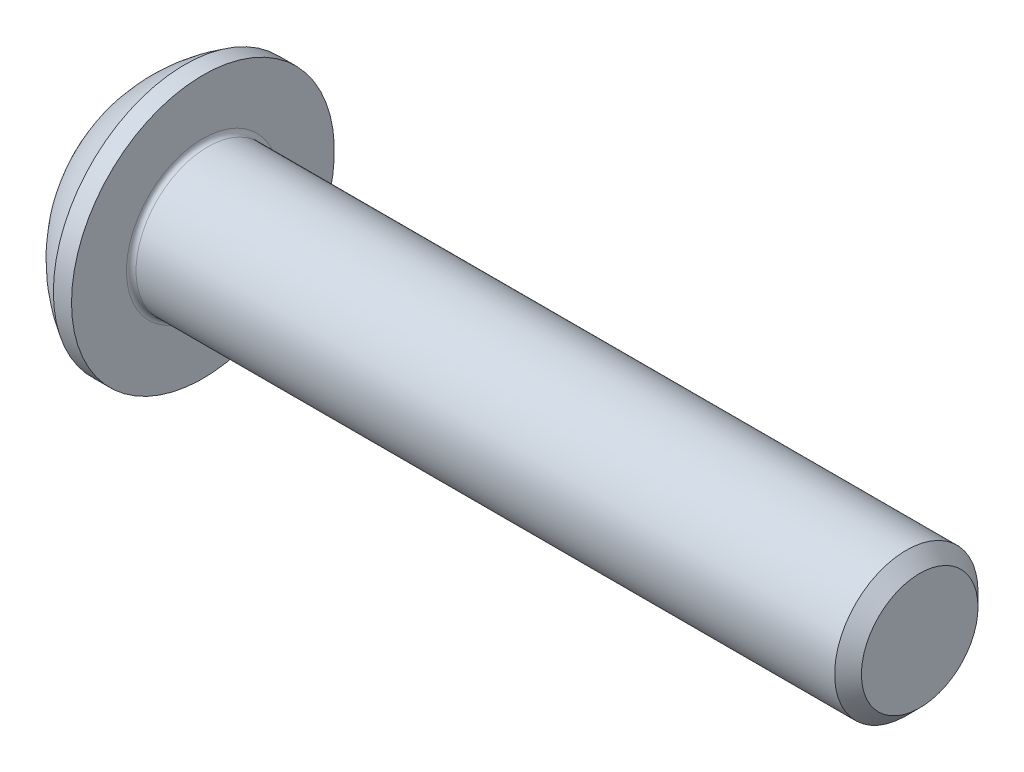
from build123d import *

# Parameters (mm, degrees)
CUT_EXTRUDE1_DEPTH        = 1.04
SKETCH4_R                 = 1.5
LARGO_Y_ANCHO_ROSCA_DEPTH = 15
FILLET1_R                 = 0.1
CHAMFER1_SIZE             = 0.2805


with BuildPart() as part:
    # Sketch1 → Revolve1 (revolve)
    with BuildSketch(Plane(origin=(0, 0, 0), x_dir=(-1, 0, 0), z_dir=(0, 0, -1))):
        with BuildLine():
            Line((-1.65, 2.75), (-1.65, 0))
            Line((-1.65, 0), (0, 0))
            Line((0, 0), (0, 1.425))
            ThreePointArc((0, 1.425), (-0.542530893, 2.176130767), (-1.27, 2.75))
            Line((-1.27, 2.75), (-1.65, 2.75))
        make_face()
    revolve(axis=Axis((1.65, 0, 0), (-1, 0, 0)))

    # Sketch2 → Cut-Extrude1 (cut)
    with BuildSketch(Plane.ZY):
        Polygon((-1, 0.577350269), (-1, -0.577350269), (0, -1.154700538), (1, -0.577350269), (1, 0.577350269), (0, 1.154700538), align=None)
    extrude(amount=-CUT_EXTRUDE1_DEPTH, mode=Mode.SUBTRACT)

    # Sketch3 → Cut-Revolve1 (revolve, cut)
    with BuildSketch(Plane.XY):
        Polygon((1.04, 1), (1.04, 0), (1.617350269, 0), align=None)
    revolve(axis=Axis((1.04, 0, 0), (1, 0, 0)), mode=Mode.SUBTRACT)

    # Sketch4 → Largo y Ancho rosca (add)
    with BuildSketch(Plane(origin=(1.65, 0, 0), x_dir=(0, 0, -1), z_dir=(1, 0, 0))):
        Circle(SKETCH4_R)
    extrude(amount=LARGO_Y_ANCHO_ROSCA_DEPTH)

    # Fillet1
    fillet1_edges = [part.edges().sort_by_distance(p)[0] for p in [
        (1.65, 0, 1.5),
    ]]
    fillet(fillet1_edges, radius=FILLET1_R)

    # Chamfer1
    chamfer1_edges = [part.edges().sort_by_distance(p)[0] for p in [
        (16.65, 0, 1.5),
    ]]
    chamfer(chamfer1_edges, length=CHAMFER1_SIZE)


solid = part.part
